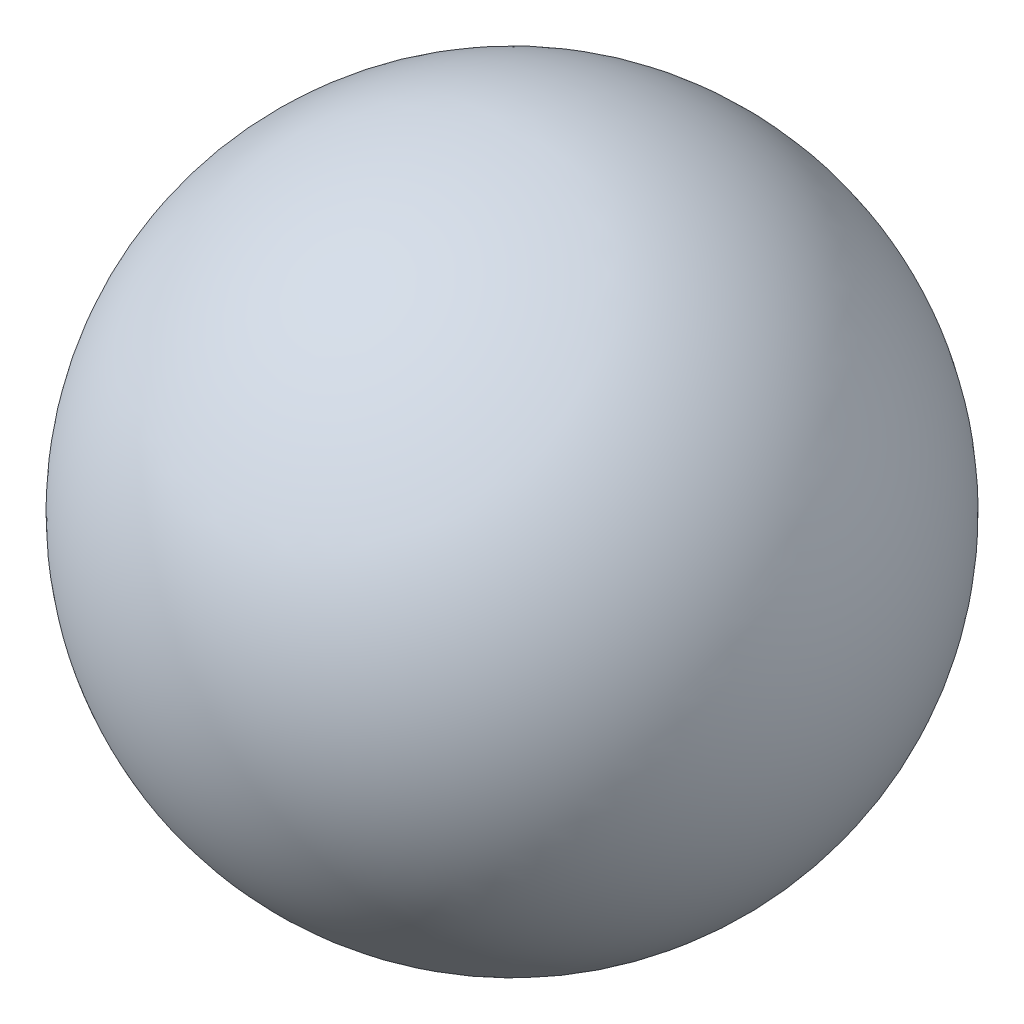
from build123d import *

# Parameters (mm, degrees)
SKETCH1_W           = 13
SKETCH1_H           = 3
LPATTERN1_COUNT     = 13
LPATTERN1_PITCH     = 1
LPATTERN1_COL_COUNT = 2
LPATTERN1_COL_PITCH = 1
SKETCH9_W           = 13.5
SKETCH9_H           = 3.5


with BuildPart() as part:
    # Sketch1 → Revolve1 (revolve)
    with BuildSketch(Plane(origin=(0, 0, 0), x_dir=(0, 0, -1), z_dir=(1, 0, 0)), mode=Mode.PRIVATE) as revolve1_sk:
        with Locations((0, 1.5)):
            Rectangle(SKETCH1_W, SKETCH1_H)
    revolve(revolve1_sk.sketch.rotate(Axis((0, 0, 8.5598), (0, 0, -1)), 180), axis=Axis((0, 0, 8.5598), (0, 0, -1)))

    # Sketch2 → Cut-Revolve1 (revolve, cut)
    with BuildSketch(Plane(origin=(0, 0, 0), x_dir=(0, 0, -1), z_dir=(1, 0, 0)), mode=Mode.PRIVATE) as cut_revolve1_sk:
        Polygon((-6.37670076, 3.020549873), (-5.513606076, 3.164398987), (-5.732870615, 2.579122931), (-5.979469096, 2.538023184), align=None)
    cut_revolve1 = revolve(cut_revolve1_sk.sketch.rotate(Axis((0, -0.178376498, 6.5), (0, 0.16439898730535757, -0.9863939238321437)), 180), axis=Axis((0, -0.178376498, 6.5), (0, 0.16439898730535757, -0.9863939238321437)), mode=Mode.SUBTRACT)

    # LPattern1: Cut-Revolve1 ×13
    with Locations(*[(0, 0, -i * LPATTERN1_PITCH) for i in range(1, LPATTERN1_COUNT)]):
        add(cut_revolve1, mode=Mode.SUBTRACT)

    # LPattern1 col: Cut-Revolve1 ×2
    with Locations(*[(0, 0, i * LPATTERN1_COL_PITCH) for i in range(1, LPATTERN1_COL_COUNT)]):
        add(cut_revolve1, mode=Mode.SUBTRACT)


with BuildPart() as body_2:
    # Sketch9 → Revolve4 (revolve)
    with BuildSketch(Plane(origin=(0, 0, 0), x_dir=(0, 0, -1), z_dir=(1, 0, 0)), mode=Mode.PRIVATE) as revolve4_sk:
        with Locations((-0.25, 1.75)):
            Rectangle(SKETCH9_W, SKETCH9_H)
    revolve(revolve4_sk.sketch.rotate(Axis((0, 0, -6.5), (0, 0, 1)), 143.735089057), axis=Axis((0, 0, -6.5), (0, 0, 1)))

    # Combine4: read off the stored shape, not the designer's step
    # Combine4: cut part
    add(part.part, mode=Mode.SUBTRACT)

    # Sketch10 → Cut-Revolve2 (revolve, cut)
    with BuildSketch(Plane(origin=(0, 0, 0), x_dir=(0, 0, -1), z_dir=(1, 0, 0)), mode=Mode.PRIVATE) as cut_revolve2_sk:
        Polygon((6.5, 0), (6.5, 3), (6.058573058, 2.558573058), (6.058573058, 0), align=None)
    revolve(cut_revolve2_sk.sketch.rotate(Axis((0, 0, -6.825150603), (0, 0, 1)), 143.735089057), axis=Axis((0, 0, -6.825150603), (0, 0, 1)), mode=Mode.SUBTRACT)


with BuildPart() as body_2_2:
    # Sketch5 → Revolve3 (revolve)
    with BuildSketch(Plane(origin=(0, 0, 0), x_dir=(0, 0, -1), z_dir=(1, 0, 0)), mode=Mode.PRIVATE) as revolve3_sk:
        with BuildLine():
            Line((6.5, 3.5), (-7, 3.5))
            Line((-7, 3.5), (-7, 0))
            Line((-7, 0), (-31.174849397, 0))
            ThreePointArc((-31.174849397, 0), (-13.93238481, 18.918537715), (6.5, 3.5))
        make_face()
    revolve(revolve3_sk.sketch.rotate(Axis((0, 0, -6.825150603), (0, 0, 1)), 143.735089057), axis=Axis((0, 0, -6.825150603), (0, 0, 1)))


solid = Compound([body_2.part, body_2_2.part])
